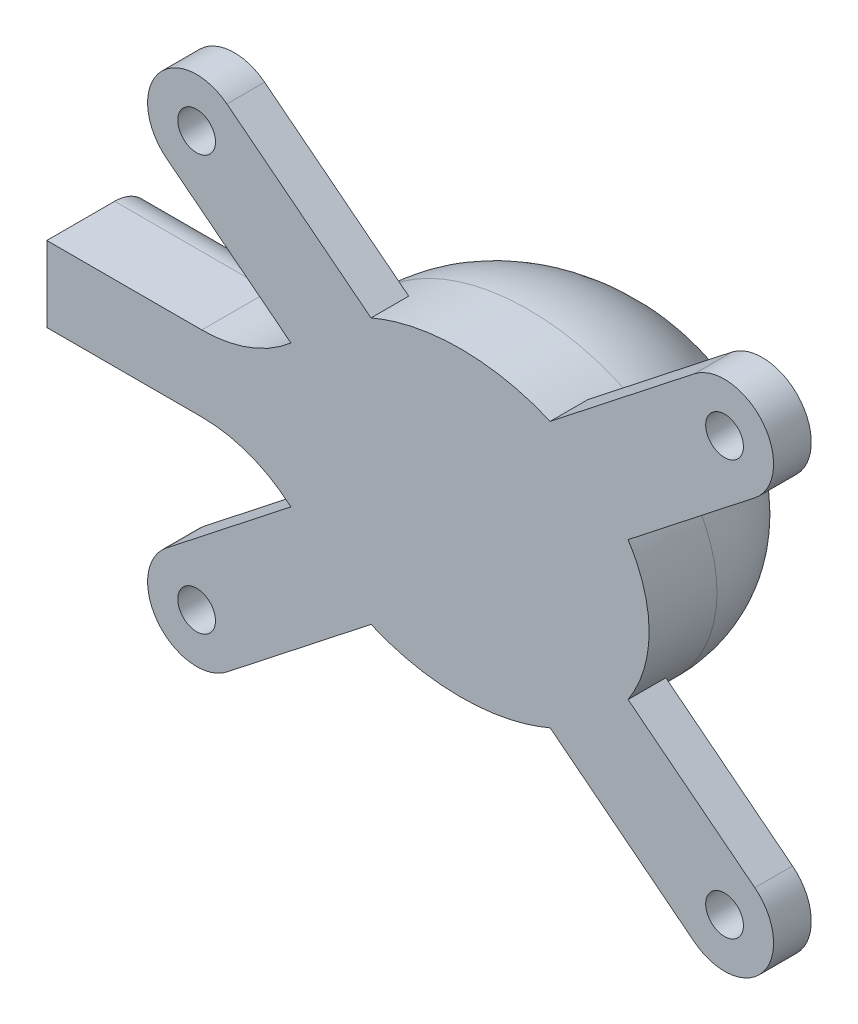
from build123d import *

# Parameters (mm, degrees)
R_VOLUTION2_ANGLE  = 180.0000000000004
R_VOLUTION4_START  = -54.865727699
R_VOLUTION4_DEPTH  = 30.659581785
CONG_1_R           = 18
ESQUISSE8_W        = 51.11842194222049
ESQUISSE8_H        = 9.999999999999993
BOSS_EXTRU_6_DEPTH = 9
ESQUISSE11_R       = 2.5000000000000115
ESQUISSE11_R_2     = 2.5000000000000027
ESQUISSE11_R_3     = 2.499999999999987
ESQUISSE11_R_4     = 2.4999999999999956
BOSS_EXTRU_8_DEPTH = 5
ESQUISSE12_RX      = 24.999999999999993
ESQUISSE12_RY      = 20
BOSS_EXTRU_9_DEPTH = 9
CONG_5_R           = 18


# Read off the part's stored shape, not the designer's step: Révolution4
with BuildPart() as part:
    # Esquisse1 → Révolution2 (revolve)
    with BuildSketch(Plane.XY):
        with BuildLine():
            Line((24.999999999999993, 0), (-24.999999999999993, 0))
            add(Edge.make_bspline(
                [(24.999999999999993, 0), (25.000000000000018, 19.999999999999996), (6.58e-15, 20), (-24.999999999999996, 20.000000000000004), (-24.999999999999993, 0)],
                knots=[3.141592653589792, 3.141592653589792, 3.141592653589792, 4.712388980384689, 4.712388980384689, 6.283185307179585, 6.283185307179585, 6.283185307179585], degree=2, weights=[1, 0.7071067811865475, 1, 0.7071067811865475, 1]))
        make_face()
    revolve(axis=Axis((24.999999999999993, 0, 0), (-1, 0, 0)), revolution_arc=R_VOLUTION2_ANGLE)

    # Révolution4 outline → Révolution4 (add)
    with BuildSketch(Plane.YZ.offset(R_VOLUTION4_START)):
        with BuildLine():
            Line((5, 0), (-5, 0))
            ThreePointArc((-5, 0), (0, -5), (5, 0))
        make_face()
    extrude(amount=R_VOLUTION4_DEPTH)

    # Congé1
    cong_1_edges = [part.edges().sort_by_distance(p)[0] for p in [
        (-24.206145913999997, 1.4e-16, -5),
    ]]
    fillet(cong_1_edges, radius=CONG_1_R)

    # Esquisse8 → Boss.-Extru.6 (add)
    with BuildSketch(Plane.XY):
        with Locations((-29.30651672831175, 0)):
            Rectangle(ESQUISSE8_W, ESQUISSE8_H)
    extrude(amount=BOSS_EXTRU_6_DEPTH)

    # Esquisse11 → Boss.-Extru.8 (add)
    with BuildSketch(Plane.XY.offset(9)):
        with BuildLine():
            Line((-39.015840087557386, -22.388930797654275), (-10.520837254179238, -1.214e-14))
            Line((-10.520837254179238, -1.214e-14), (-39.015840087557386, 22.38893079765424))
            ThreePointArc((-39.015840087557386, 22.38893079765424), (-40.11106920234576, 31.515840087557358), (-30.984159912442646, 32.61106920234573))
            Line((-30.984159912442646, 32.61106920234573), (1.041e-14, 8.266372128283678))
            Line((1.041e-14, 8.266372128283678), (30.984159912442635, 32.611069202345746))
            ThreePointArc((30.984159912442635, 32.611069202345746), (40.11106920234576, 31.515840087557383), (39.015840087557386, 22.38893079765424))
            Line((39.015840087557386, 22.38893079765424), (10.520837254179254, -1.518e-14))
            Line((10.520837254179254, -1.518e-14), (39.015840087557386, -22.388930797654243))
            ThreePointArc((39.015840087557386, -22.388930797654243), (40.111069202345746, -31.515840087557372), (30.98415991244264, -32.61106920234575))
            Line((30.98415991244264, -32.61106920234575), (4.77e-15, -8.2663721282837))
            Line((4.77e-15, -8.2663721282837), (-30.984159912442642, -32.611069202345774))
            ThreePointArc((-30.984159912442642, -32.611069202345774), (-40.11106920234576, -31.51584008755739), (-39.015840087557386, -22.388930797654275))
        make_face()
        with Locations((-35.000000000000014, -27.50000000000002)):
            Circle(ESQUISSE11_R, mode=Mode.SUBTRACT)
        with Locations((-35.000000000000014, 27.499999999999986)):
            Circle(ESQUISSE11_R_2, mode=Mode.SUBTRACT)
        with Locations((35, 27.5)):
            Circle(ESQUISSE11_R_3, mode=Mode.SUBTRACT)
        with Locations((35, -27.500000000000007)):
            Circle(ESQUISSE11_R_4, mode=Mode.SUBTRACT)
    extrude(amount=-BOSS_EXTRU_8_DEPTH)

    # Esquisse12 → Boss.-Extru.9 (add)
    with BuildSketch(Plane.XY):
        with Locations((0, 0)):
            Ellipse(ESQUISSE12_RX, ESQUISSE12_RY)
    extrude(amount=BOSS_EXTRU_9_DEPTH)

    # Congé5
    cong_5_edges = [part.edges().sort_by_distance(p)[0] for p in [
        (-24.206145913796348, 4.9999999999999964, 4.499999999999834),
        (-24.20614591379635, -4.9999999999999964, 4.499999999999834),
    ]]
    fillet(cong_5_edges, radius=CONG_5_R - 0.0001)  # a hair under: the kernel refuses the full size


solid = part.part
